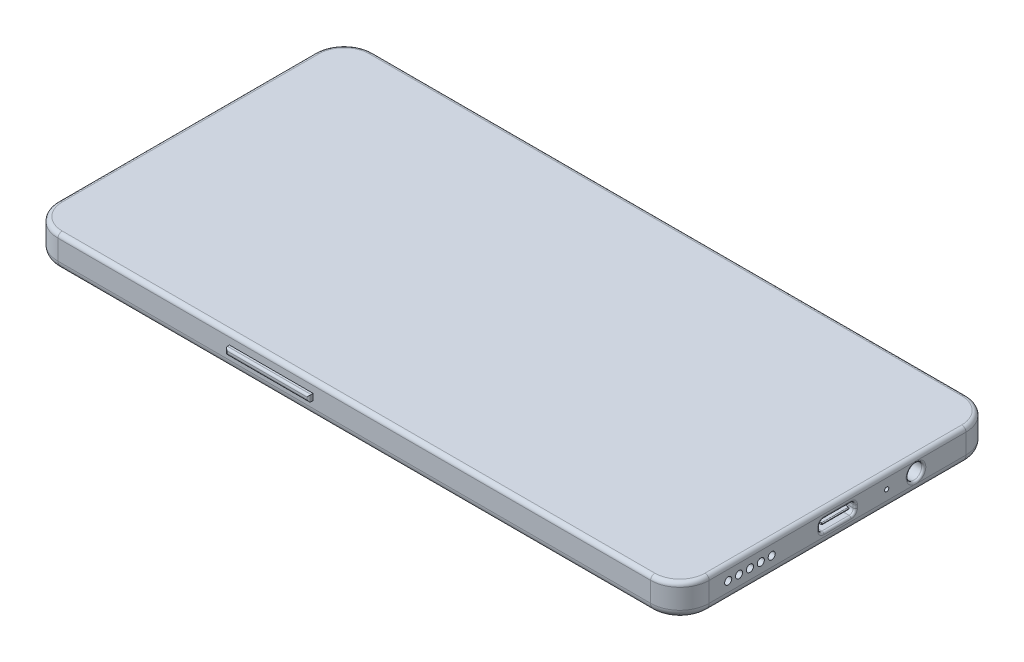
from build123d import *

# Parameters (mm, degrees)
SKETCH1_W                = 155.7
SKETCH1_H                = 75.4
BOSS_EXTRUDE1_DEPTH      = 7.75
FILLET1_R                = 7
FILLET2_R                = 1
FILLET3_R                = 2
BOSS_EXTRUDE2_DEPTH      = 0.6
SKETCH3_R                = 4
CUT_EXTRUDE1_DEPTH       = 0.1
SKETCH4_R                = 2
CUT_EXTRUDE2_DEPTH       = 0.1
CUT_EXTRUDE3_DEPTH       = 0.1
SKETCH6_W                = 6.840301521
SKETCH6_H                = 12.5
CUT_EXTRUDE4_DEPTH       = 0.1
FILLET4_R                = 2
FILLET5_R                = 0.5
BOSS_EXTRUDE3_DEPTH      = 0.2
BOSS_EXTRUDE3_DEPTH_BACK = 0.2
SKETCH7_W                = 12
SKETCH7_H                = 2
FILLET6_R                = 1
CUT_EXTRUDE5_DEPTH       = 0.5
BOSS_EXTRUDE4_DEPTH      = 0.6
FILLET7_R                = 0.1
SKETCH11_W               = 8.5
SKETCH11_H               = 2.75
CUT_EXTRUDE6_DEPTH       = 6.5
FILLET8_R                = 1
SKETCH12_W               = 6.5
SKETCH12_H               = 0.4
BOSS_EXTRUDE5_DEPTH      = 6
FILLET9_R                = 0.5
SKETCH13_R               = 0.85
CUT_EXTRUDE7_DEPTH       = 6
SKETCH14_R               = 1.85
CUT_EXTRUDE8_DEPTH       = 14
FILLET10_R               = 0.5
FILLET12_R               = 0.2
SKETCH15_R               = 0.5
CUT_EXTRUDE9_DEPTH       = 6
SKETCH16_R               = 0.5
CUT_EXTRUDE10_DEPTH      = 6
SKETCH18_W               = 20
SKETCH18_H               = 1.5
BOSS_EXTRUDE6_DEPTH      = 1
FILLET13_R               = 0.5


# Some blends are built 0.0001 mm under size
with BuildPart() as part:
    # Sketch1 → Boss-Extrude1 (new body)
    with BuildSketch(Plane(origin=(0, 0, 0), x_dir=(1, 0, 0), z_dir=(0, 1, 0))):
        Rectangle(SKETCH1_W, SKETCH1_H)
    extrude(amount=BOSS_EXTRUDE1_DEPTH)

    # Fillet1
    fillet1_edges = [part.edges().sort_by_distance(p)[0] for p in [
        (77.85, 3.875, 37.7),
        (-77.85, 3.875, 37.7),
        (-77.85, 3.875, -37.7),
        (77.85, 3.875, -37.7),
    ]]
    fillet(fillet1_edges, radius=FILLET1_R)

    # Fillet2
    fillet2_edges = [part.edges().sort_by_distance(p)[0] for p in [
        (-77.85, 7.75, 0),
        (0, 7.75, -37.7),
        (77.85, 7.75, 0),
        (0, 7.75, 37.7),
        (-75.799747468, 7.75, 35.649747468),
        (75.799747468, 7.75, 35.649747468),
        (75.799747468, 7.75, -35.649747468),
        (-75.799747468, 7.75, -35.649747468),
    ]]
    fillet(fillet2_edges, radius=FILLET2_R)

    # Fillet3
    fillet3_edges = [part.edges().sort_by_distance(p)[0] for p in [
        (-77.85, 0, 0),
        (77.85, 0, 0),
        (0, 0, 37.7),
        (0, 0, -37.7),
        (-75.799747468, 0, 35.649747468),
        (75.799747468, 0, 35.649747468),
        (75.799747468, 0, -35.649747468),
        (-75.799747468, 0, -35.649747468),
    ]]
    fillet(fillet3_edges, radius=FILLET3_R)

    # Sketch2 → Boss-Extrude2 (add)
    with BuildSketch(Plane.XZ):
        with BuildLine():
            Line((-49.85, -5.575), (-59.85, -5.575))
            ThreePointArc((-59.85, -5.575), (-65.425, 0), (-59.85, 5.575))
            Line((-59.85, 5.575), (-49.85, 5.575))
            ThreePointArc((-49.85, 5.575), (-44.275, 0), (-49.85, -5.575))
        make_face()
    extrude(amount=BOSS_EXTRUDE2_DEPTH)

    # Sketch3 → Cut-Extrude1 (cut)
    with BuildSketch(Plane.XZ.offset(0.6)):
        with Locations(Location((-49.86189839, 0.010581739, 0), (0, 0, 270))):
            Circle(SKETCH3_R)
        with Locations(Location((-59.86189839, 0, 0), (0, 0, 270))):
            Circle(SKETCH3_R)
    extrude(amount=-CUT_EXTRUDE1_DEPTH, mode=Mode.SUBTRACT)

    # Sketch4 → Cut-Extrude2 (cut)
    with BuildSketch(Plane.XZ.offset(0.5)):
        with Locations(Location((-49.86189839, 0.010581739, 0), (0, 0, 270))):
            Circle(SKETCH4_R)
        with Locations(Location((-59.86189839, 0, 0), (0, 0, 270))):
            Circle(SKETCH4_R)
    extrude(amount=-CUT_EXTRUDE2_DEPTH, mode=Mode.SUBTRACT)

    # Sketch5 → Cut-Extrude3 (cut)
    with BuildSketch(Plane.XZ):
        with BuildLine():
            Line((-41.11189839, -2.647579151), (-41.11189839, 2.647579151))
            ThreePointArc((-41.11189839, 2.647579151), (-39.86189839, 3.897579151), (-38.61189839, 2.647579151))
            Line((-38.61189839, 2.647579151), (-38.61189839, -2.647579151))
            ThreePointArc((-38.61189839, -2.647579151), (-39.86189839, -3.897579151), (-41.11189839, -2.647579151))
        make_face()
    extrude(amount=-CUT_EXTRUDE3_DEPTH, mode=Mode.SUBTRACT)

    # Sketch6 → Cut-Extrude4 (cut)
    with BuildSketch(Plane.XZ):
        with Locations((-32.69174763, 0)):
            Rectangle(SKETCH6_W, SKETCH6_H)
    extrude(amount=-CUT_EXTRUDE4_DEPTH, mode=Mode.SUBTRACT)

    # Fillet4
    fillet4_edges = [part.edges().sort_by_distance(p)[0] for p in [
        (-36.11189839, 0.05, -6.25),
        (-36.11189839, 0.05, 6.25),
        (-29.271596869, 0.05, 6.25),
        (-29.271596869, 0.05, -6.25),
    ]]
    fillet(fillet4_edges, radius=FILLET4_R)

    # Fillet5
    # the kernel refuses this fillet: 0.5 mm, written as the material it adds along each edge
    with BuildSketch(Plane(origin=(-34.11189839, 0.1, 4.25), x_dir=(-1, 0, 0), z_dir=(0, 0, -1))) as fillet5_piece_1:
        with BuildLine():
            CenterArc((1.7, -0.5), FILLET5_R, 53.130102354, 36.869897646)
            Line((1.7, 0), (1.7, 0.01))
            Line((1.7, 0.01), (2, 0.01))
            Line((2, 0.01), (2.01, 0))
            ThreePointArc((2.01, 0), (2.01, -0.05), (2.006, -0.092))
            Line((2.006, -0.092), (2, -0.1))
        make_face()
    revolve(axis=Axis((-34.11189839, 0.1, 4.25), (0, 1, 0)), revolution_arc=90)
    with BuildSketch(Plane(origin=(-34.11189839, 0.1, 6.25), x_dir=(0, -1, 0), z_dir=(1, 0, 0)), Plane(origin=(-31.271596869, 0.1, -6.25), x_dir=(0, -1, 0), z_dir=(-1, 0, 0))) as fillet5_piece_2:
        with BuildLine():
            CenterArc((0.5, 0.3), FILLET5_R, 180, 36.869897646)
            Line((0, 0.3), (-0.01, 0.3))
            Line((-0.01, 0.3), (-0.01, 0))
            Line((-0.01, 0), (0, -0.01))
            ThreePointArc((0, -0.01), (0.05, -0.01), (0.092, -0.006))
            Line((0.092, -0.006), (0.1, 0))
        make_face()
    extrude(amount=2.84030152)
    with BuildSketch(Plane(origin=(-31.271596869, 0.1, 4.25), x_dir=(0, 0, 1), z_dir=(-1, 0, 0))) as fillet5_piece_3:
        with BuildLine():
            CenterArc((1.7, -0.5), FILLET5_R, 53.130102354, 36.869897646)
            Line((1.7, 0), (1.7, 0.01))
            Line((1.7, 0.01), (2, 0.01))
            Line((2, 0.01), (2.01, 0))
            ThreePointArc((2.01, 0), (2.01, -0.05), (2.006, -0.092))
            Line((2.006, -0.092), (2, -0.1))
        make_face()
    revolve(axis=Axis((-31.271596869, 0.1, 4.25), (0, 1, 0)), revolution_arc=90)
    with BuildSketch(Plane(origin=(-29.271596869, 0.1, 4.25), x_dir=(0, -1, 0), z_dir=(0, 0, -1)), Plane(origin=(-36.11189839, 0.1, -4.25), x_dir=(0, -1, 0), z_dir=(0, 0, 1))) as fillet5_piece_4:
        with BuildLine():
            CenterArc((0.5, 0.3), FILLET5_R, 180, 36.869897646)
            Line((0, 0.3), (-0.01, 0.3))
            Line((-0.01, 0.3), (-0.01, 0))
            Line((-0.01, 0), (0, -0.01))
            ThreePointArc((0, -0.01), (0.05, -0.01), (0.092, -0.006))
            Line((0.092, -0.006), (0.1, 0))
        make_face()
    extrude(amount=8.5)
    with BuildSketch(Plane(origin=(-31.271596869, 0.1, -4.25), x_dir=(0, 0, -1), z_dir=(-1, 0, 0))) as fillet5_piece_5:
        with BuildLine():
            CenterArc((1.7, 0.5), FILLET5_R, 270, 36.869897646)
            Line((1.7, 0), (1.7, -0.01))
            Line((1.7, -0.01), (2, -0.01))
            Line((2, -0.01), (2.01, 0))
            ThreePointArc((2.01, 0), (2.01, 0.05), (2.006, 0.092))
            Line((2.006, 0.092), (2, 0.1))
        make_face()
    revolve(axis=Axis((-31.271596869, 0.1, -4.25), (0, -1, 0)), revolution_arc=90)
    with BuildSketch(Plane(origin=(-34.11189839, 0.1, -4.25), x_dir=(0, 0, -1), z_dir=(1, 0, 0))) as fillet5_piece_6:
        with BuildLine():
            CenterArc((1.7, -0.5), FILLET5_R, 53.130102354, 36.869897646)
            Line((1.7, 0), (1.7, 0.01))
            Line((1.7, 0.01), (2, 0.01))
            Line((2, 0.01), (2.01, 0))
            ThreePointArc((2.01, 0), (2.01, -0.05), (2.006, -0.092))
            Line((2.006, -0.092), (2, -0.1))
        make_face()
    revolve(axis=Axis((-34.11189839, 0.1, -4.25), (0, 1, 0)), revolution_arc=90)

    # Sketch7 → Boss-Extrude3 (add, two sides: drawn at the far end of the back side and taken through both)
    with BuildSketch(Plane.XY.offset(-37.7).offset(-BOSS_EXTRUDE3_DEPTH_BACK)):
        with Locations((-23.85, 4.375)):
            Rectangle(SKETCH7_W, SKETCH7_H)
    extrude(amount=BOSS_EXTRUDE3_DEPTH + BOSS_EXTRUDE3_DEPTH_BACK)

    # Fillet6
    fillet6_edges = [part.edges().sort_by_distance(p)[0] for p in [
        (-17.85, 3.375, -37.8),
        (-17.85, 5.375, -37.8),
        (-29.85, 3.375, -37.8),
        (-29.85, 5.375, -37.8),
    ]]
    fillet(fillet6_edges, radius=FILLET6_R - 0.0001)  # a hair under: the kernel refuses the full size

    # Sketch8 → Cut-Extrude5 (cut)
    with BuildSketch(Plane(origin=(0, 0, -37.7), x_dir=(-1, 0, 0), z_dir=(0, 0, -1))):
        with BuildLine():
            Line((48.114993193, 3.475), (39.114993193, 3.475))
            ThreePointArc((39.114993193, 3.475), (38.214993193, 4.375), (39.114993193, 5.275))
            Line((39.114993193, 5.275), (48.114993193, 5.275))
            ThreePointArc((48.114993193, 5.275), (49.014993193, 4.375), (48.114993193, 3.475))
        make_face()
    extrude(amount=-CUT_EXTRUDE5_DEPTH, mode=Mode.SUBTRACT)

    # Sketch9 → Boss-Extrude4 (add)
    with BuildSketch(Plane(origin=(0, 0, -37.2), x_dir=(-1, 0, 0), z_dir=(0, 0, -1))):
        with BuildLine():
            Line((47.918302414, 3.475), (39.518302414, 3.475))
            ThreePointArc((39.518302414, 3.475), (38.618302414, 4.375), (39.518302414, 5.275))
            Line((39.518302414, 5.275), (47.918302414, 5.275))
            ThreePointArc((47.918302414, 5.275), (48.818302414, 4.375), (47.918302414, 3.475))
        make_face()
    extrude(amount=BOSS_EXTRUDE4_DEPTH)

    # Fillet7
    fillet7_edges = [part.edges().sort_by_distance(p)[0] for p in [
        (-43.718302414, 3.475, -37.8),
        (-38.618302414, 4.375, -37.8),
        (-43.718302414, 5.275, -37.8),
        (-48.818302414, 4.375, -37.8),
    ]]
    fillet(fillet7_edges, radius=FILLET7_R - 0.0001)  # a hair under: the kernel refuses the full size

    # Sketch11 → Cut-Extrude6 (cut)
    with BuildSketch(Plane(origin=(77.85, 0, 0), x_dir=(0, 0, -1), z_dir=(1, 0, 0))):
        with Locations((0, 4.375)):
            Rectangle(SKETCH11_W, SKETCH11_H)
    extrude(amount=-CUT_EXTRUDE6_DEPTH, mode=Mode.SUBTRACT)

    # Fillet8
    fillet8_edges = [part.edges().sort_by_distance(p)[0] for p in [
        (74.6, 3, 4.25),
        (74.6, 5.75, 4.25),
        (74.6, 5.75, -4.25),
        (74.6, 3, -4.25),
    ]]
    fillet(fillet8_edges, radius=FILLET8_R)

    # Sketch12 → Boss-Extrude5 (add)
    with BuildSketch(Plane(origin=(71.35, 0, 0), x_dir=(0, 0, -1), z_dir=(1, 0, 0))):
        with Locations((0.072516481, 4.375)):
            Rectangle(SKETCH12_W, SKETCH12_H)
    extrude(amount=BOSS_EXTRUDE5_DEPTH)

    # Fillet9
    fillet9_edges = [part.edges().sort_by_distance(p)[0] for p in [
        (77.85, 4.375, 4.25),
        (77.85, 5.75, 0),
        (77.85, 4.375, -4.25),
        (77.85, 3, 0),
        (77.85, 5.457106781, 3.957106781),
        (77.85, 5.457106781, -3.957106781),
        (77.85, 3.292893219, 3.957106781),
        (77.85, 3.292893219, -3.957106781),
    ]]
    fillet(fillet9_edges, radius=FILLET9_R)

    # Sketch13 → Cut-Extrude7 (cut)
    with BuildSketch(Plane(origin=(77.85, 0, 0), x_dir=(0, 0, -1), z_dir=(1, 0, 0))):
        with Locations((-15.75, 4.375)):
            Circle(SKETCH13_R)
        with Locations((-18.35, 4.375)):
            Circle(SKETCH13_R)
        with Locations((-20.95, 4.375)):
            Circle(SKETCH13_R)
        with Locations((-23.55, 4.375)):
            Circle(SKETCH13_R)
        with Locations((-26.15, 4.375)):
            Circle(SKETCH13_R)
    extrude(amount=-CUT_EXTRUDE7_DEPTH, mode=Mode.SUBTRACT)

    # Sketch14 → Cut-Extrude8 (cut)
    with BuildSketch(Plane(origin=(77.85, 0, 0), x_dir=(0, 0, -1), z_dir=(1, 0, 0))):
        with Locations((18.75, 4.375)):
            Circle(SKETCH14_R)
    extrude(amount=-CUT_EXTRUDE8_DEPTH, mode=Mode.SUBTRACT)

    # Fillet10
    fillet10_edges = [part.edges().sort_by_distance(p)[0] for p in [
        (77.85, 4.375, -16.9),
    ]]
    fillet(fillet10_edges, radius=FILLET10_R)

    # Fillet12
    fillet12_edges = [part.edges().sort_by_distance(p)[0] for p in [
        (77.35, 4.375, 3.177483519),
        (77.35, 4.175, -0.072516481),
        (77.35, 4.375, -3.322516481),
        (77.35, 4.575, -0.072516481),
    ]]
    fillet(fillet12_edges, radius=FILLET12_R - 0.0001)  # a hair under: the kernel refuses the full size

    # Sketch15 → Cut-Extrude9 (cut)
    with BuildSketch(Plane(origin=(77.85, 0, 0), x_dir=(0, 0, -1), z_dir=(1, 0, 0))):
        with Locations((11.75, 4.375)):
            Circle(SKETCH15_R)
    extrude(amount=-CUT_EXTRUDE9_DEPTH, mode=Mode.SUBTRACT)

    # Sketch16 → Cut-Extrude10 (cut)
    with BuildSketch(Plane.ZY.offset(77.85)):
        with Locations((-16.7, 4.375)):
            Circle(SKETCH16_R)
    extrude(amount=-CUT_EXTRUDE10_DEPTH, mode=Mode.SUBTRACT)

    # Sketch18 → Boss-Extrude6 (add)
    with BuildSketch(Plane.XY.offset(37.7)):
        with Locations((-19.85, 4.375)):
            Rectangle(SKETCH18_W, SKETCH18_H)
    extrude(amount=BOSS_EXTRUDE6_DEPTH)

    # Fillet13
    fillet13_edges = [part.edges().sort_by_distance(p)[0] for p in [
        (-9.85, 4.375, 38.7),
        (-19.85, 5.125, 38.7),
        (-29.85, 4.375, 38.7),
        (-19.85, 3.625, 38.7),
    ]]
    fillet(fillet13_edges, radius=FILLET13_R)


solid = part.part
